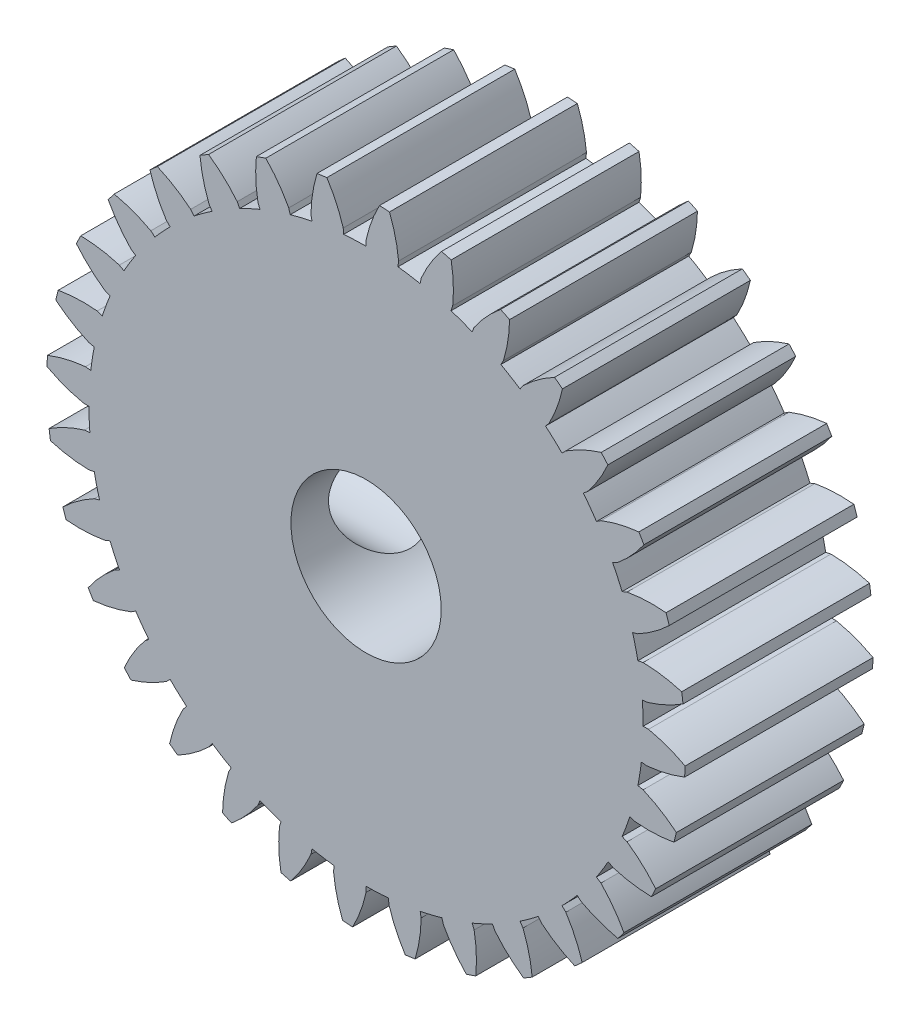
from build123d import *

# Parameters (mm, degrees)
BOSS_EXTRUDE1_DEPTH = 5
CIRPATTERN1_COUNT   = 32
SKETCH6_R           = 7.375
SKETCH6_R_2         = 2
BOSS_EXTRUDE3_DEPTH = 5
SKETCH9_R           = 1.5
CUT_EXTRUDE2_DEPTH  = 9
CUT_EXTRUDE3_START  = 1
CUT_EXTRUDE3_DEPTH  = 3


with BuildPart() as part:
    # Sketch3 → Boss-Extrude1 (new body)
    with BuildSketch(Plane.XY):
        with BuildLine():
            Line((0.865619323, 7.467538106), (0.849206214, 7.32594525))
            ThreePointArc((0.849206214, 7.32594525), (0.425310934, 7.362726099), (0, 7.375))
            Line((0, 7.375), (0, 7.517540966))
            ThreePointArc((0, 7.517540966), (0.144610368, 8.017503247), (0.357372444, 8.492484026))
            ThreePointArc((0.357372444, 8.492484026), (0.490188873, 8.485853809), (0.622885322, 8.477146564))
            ThreePointArc((0.622885322, 8.477146564), (0.779539788, 7.980826285), (0.865619323, 7.467538106))
        make_face()
    extrude(amount=BOSS_EXTRUDE1_DEPTH)


with BuildPart() as cirpattern1_1:
    # CirPattern1: pattern copy
    add(part.part.rotate(Axis((0, 0, 0), (0, 0, 1)), 1 * 360 / CIRPATTERN1_COUNT))


with BuildPart() as cirpattern1_2:
    # CirPattern1: pattern copy
    add(part.part.rotate(Axis((0, 0, 0), (0, 0, 1)), 2 * 360 / CIRPATTERN1_COUNT))


with BuildPart() as cirpattern1_3:
    # CirPattern1: pattern copy
    add(part.part.rotate(Axis((0, 0, 0), (0, 0, 1)), 3 * 360 / CIRPATTERN1_COUNT))


with BuildPart() as cirpattern1_4:
    # CirPattern1: pattern copy
    add(part.part.rotate(Axis((0, 0, 0), (0, 0, 1)), 4 * 360 / CIRPATTERN1_COUNT))


with BuildPart() as cirpattern1_5:
    # CirPattern1: pattern copy
    add(part.part.rotate(Axis((0, 0, 0), (0, 0, 1)), 5 * 360 / CIRPATTERN1_COUNT))


with BuildPart() as cirpattern1_6:
    # CirPattern1: pattern copy
    add(part.part.rotate(Axis((0, 0, 0), (0, 0, 1)), 6 * 360 / CIRPATTERN1_COUNT))


with BuildPart() as cirpattern1_7:
    # CirPattern1: pattern copy
    add(part.part.rotate(Axis((0, 0, 0), (0, 0, 1)), 7 * 360 / CIRPATTERN1_COUNT))


with BuildPart() as cirpattern1_8:
    # CirPattern1: pattern copy
    add(part.part.rotate(Axis((0, 0, 0), (0, 0, 1)), 8 * 360 / CIRPATTERN1_COUNT))


with BuildPart() as cirpattern1_9:
    # CirPattern1: pattern copy
    add(part.part.rotate(Axis((0, 0, 0), (0, 0, 1)), 9 * 360 / CIRPATTERN1_COUNT))


with BuildPart() as cirpattern1_10:
    # CirPattern1: pattern copy
    add(part.part.rotate(Axis((0, 0, 0), (0, 0, 1)), 10 * 360 / CIRPATTERN1_COUNT))


with BuildPart() as cirpattern1_11:
    # CirPattern1: pattern copy
    add(part.part.rotate(Axis((0, 0, 0), (0, 0, 1)), 11 * 360 / CIRPATTERN1_COUNT))


with BuildPart() as cirpattern1_12:
    # CirPattern1: pattern copy
    add(part.part.rotate(Axis((0, 0, 0), (0, 0, 1)), 12 * 360 / CIRPATTERN1_COUNT))


with BuildPart() as cirpattern1_13:
    # CirPattern1: pattern copy
    add(part.part.rotate(Axis((0, 0, 0), (0, 0, 1)), 13 * 360 / CIRPATTERN1_COUNT))


with BuildPart() as cirpattern1_14:
    # CirPattern1: pattern copy
    add(part.part.rotate(Axis((0, 0, 0), (0, 0, 1)), 14 * 360 / CIRPATTERN1_COUNT))


with BuildPart() as cirpattern1_15:
    # CirPattern1: pattern copy
    add(part.part.rotate(Axis((0, 0, 0), (0, 0, 1)), 15 * 360 / CIRPATTERN1_COUNT))


with BuildPart() as cirpattern1_16:
    # CirPattern1: pattern copy
    add(part.part.rotate(Axis((0, 0, 0), (0, 0, 1)), 16 * 360 / CIRPATTERN1_COUNT))


with BuildPart() as cirpattern1_17:
    # CirPattern1: pattern copy
    add(part.part.rotate(Axis((0, 0, 0), (0, 0, 1)), 17 * 360 / CIRPATTERN1_COUNT))


with BuildPart() as cirpattern1_18:
    # CirPattern1: pattern copy
    add(part.part.rotate(Axis((0, 0, 0), (0, 0, 1)), 18 * 360 / CIRPATTERN1_COUNT))


with BuildPart() as cirpattern1_19:
    # CirPattern1: pattern copy
    add(part.part.rotate(Axis((0, 0, 0), (0, 0, 1)), 19 * 360 / CIRPATTERN1_COUNT))


with BuildPart() as cirpattern1_20:
    # CirPattern1: pattern copy
    add(part.part.rotate(Axis((0, 0, 0), (0, 0, 1)), 20 * 360 / CIRPATTERN1_COUNT))


with BuildPart() as cirpattern1_21:
    # CirPattern1: pattern copy
    add(part.part.rotate(Axis((0, 0, 0), (0, 0, 1)), 21 * 360 / CIRPATTERN1_COUNT))


with BuildPart() as cirpattern1_22:
    # CirPattern1: pattern copy
    add(part.part.rotate(Axis((0, 0, 0), (0, 0, 1)), 22 * 360 / CIRPATTERN1_COUNT))


with BuildPart() as cirpattern1_23:
    # CirPattern1: pattern copy
    add(part.part.rotate(Axis((0, 0, 0), (0, 0, 1)), 23 * 360 / CIRPATTERN1_COUNT))


with BuildPart() as cirpattern1_24:
    # CirPattern1: pattern copy
    add(part.part.rotate(Axis((0, 0, 0), (0, 0, 1)), 24 * 360 / CIRPATTERN1_COUNT))


with BuildPart() as cirpattern1_25:
    # CirPattern1: pattern copy
    add(part.part.rotate(Axis((0, 0, 0), (0, 0, 1)), 25 * 360 / CIRPATTERN1_COUNT))


with BuildPart() as cirpattern1_26:
    # CirPattern1: pattern copy
    add(part.part.rotate(Axis((0, 0, 0), (0, 0, 1)), 26 * 360 / CIRPATTERN1_COUNT))


with BuildPart() as cirpattern1_27:
    # CirPattern1: pattern copy
    add(part.part.rotate(Axis((0, 0, 0), (0, 0, 1)), 27 * 360 / CIRPATTERN1_COUNT))


with BuildPart() as cirpattern1_28:
    # CirPattern1: pattern copy
    add(part.part.rotate(Axis((0, 0, 0), (0, 0, 1)), 28 * 360 / CIRPATTERN1_COUNT))


with BuildPart() as cirpattern1_29:
    # CirPattern1: pattern copy
    add(part.part.rotate(Axis((0, 0, 0), (0, 0, 1)), 29 * 360 / CIRPATTERN1_COUNT))


with BuildPart() as cirpattern1_30:
    # CirPattern1: pattern copy
    add(part.part.rotate(Axis((0, 0, 0), (0, 0, 1)), 30 * 360 / CIRPATTERN1_COUNT))


with BuildPart() as cirpattern1_31:
    # CirPattern1: pattern copy
    add(part.part.rotate(Axis((0, 0, 0), (0, 0, 1)), 31 * 360 / CIRPATTERN1_COUNT))


with BuildPart() as part_1:
    add(part.part)

    add(cirpattern1_1.part)  # Boss-Extrude3 merges CirPattern1_1

    add(cirpattern1_2.part)  # Boss-Extrude3 merges CirPattern1_2

    add(cirpattern1_3.part)  # Boss-Extrude3 merges CirPattern1_3

    add(cirpattern1_4.part)  # Boss-Extrude3 merges CirPattern1_4

    add(cirpattern1_5.part)  # Boss-Extrude3 merges CirPattern1_5

    add(cirpattern1_6.part)  # Boss-Extrude3 merges CirPattern1_6

    add(cirpattern1_7.part)  # Boss-Extrude3 merges CirPattern1_7

    add(cirpattern1_8.part)  # Boss-Extrude3 merges CirPattern1_8

    add(cirpattern1_9.part)  # Boss-Extrude3 merges CirPattern1_9

    add(cirpattern1_10.part)  # Boss-Extrude3 merges CirPattern1_10

    add(cirpattern1_11.part)  # Boss-Extrude3 merges CirPattern1_11

    add(cirpattern1_12.part)  # Boss-Extrude3 merges CirPattern1_12

    add(cirpattern1_13.part)  # Boss-Extrude3 merges CirPattern1_13

    add(cirpattern1_14.part)  # Boss-Extrude3 merges CirPattern1_14

    add(cirpattern1_15.part)  # Boss-Extrude3 merges CirPattern1_15

    add(cirpattern1_16.part)  # Boss-Extrude3 merges CirPattern1_16

    add(cirpattern1_17.part)  # Boss-Extrude3 merges CirPattern1_17

    add(cirpattern1_18.part)  # Boss-Extrude3 merges CirPattern1_18

    add(cirpattern1_19.part)  # Boss-Extrude3 merges CirPattern1_19

    add(cirpattern1_20.part)  # Boss-Extrude3 merges CirPattern1_20

    add(cirpattern1_21.part)  # Boss-Extrude3 merges CirPattern1_21

    add(cirpattern1_22.part)  # Boss-Extrude3 merges CirPattern1_22

    add(cirpattern1_23.part)  # Boss-Extrude3 merges CirPattern1_23

    add(cirpattern1_24.part)  # Boss-Extrude3 merges CirPattern1_24

    add(cirpattern1_25.part)  # Boss-Extrude3 merges CirPattern1_25

    add(cirpattern1_26.part)  # Boss-Extrude3 merges CirPattern1_26

    add(cirpattern1_27.part)  # Boss-Extrude3 merges CirPattern1_27

    add(cirpattern1_28.part)  # Boss-Extrude3 merges CirPattern1_28

    add(cirpattern1_29.part)  # Boss-Extrude3 merges CirPattern1_29

    add(cirpattern1_30.part)  # Boss-Extrude3 merges CirPattern1_30

    add(cirpattern1_31.part)  # Boss-Extrude3 merges CirPattern1_31
    # Sketch6 → Boss-Extrude3 (add)
    with BuildSketch(Plane.XY):
        Circle(SKETCH6_R)
        Circle(SKETCH6_R_2, mode=Mode.SUBTRACT)
    extrude(amount=BOSS_EXTRUDE3_DEPTH)

    # Sketch9 → Cut-Extrude2 (cut)
    with BuildSketch(Plane(origin=(0, 0, 0), x_dir=(0, 0, -1), z_dir=(1, 0, 0))):
        with Locations(Location((-2.5, 0, 0), (0, 0, 180))):
            Circle(SKETCH9_R)
    extrude(amount=-CUT_EXTRUDE2_DEPTH, mode=Mode.SUBTRACT)

    # Cut-Extrude3: read off the stored shape, not the designer's step
    # Cut-Extrude3 outline → Cut-Extrude3 (cut)
    with BuildSketch(Plane.XY.offset(CUT_EXTRUDE3_START)):
        with BuildLine():
            ThreePointArc((-7.375, 0), (-7.362726099, 0.425310934), (-7.32594525, 0.849206214))
            Line((-7.32594525, 0.849206214), (-7.467538106, 0.865619323))
            ThreePointArc((-7.467538106, 0.865619323), (-7.980826285, 0.779539788), (-8.477146564, 0.622885322))
            ThreePointArc((-8.477146564, 0.622885322), (-8.485853809, 0.490188873), (-8.492484026, 0.357372444))
            ThreePointArc((-8.492484026, 0.357372444), (-8.017503247, 0.144610368), (-7.517540966, 0))
            Line((-7.517540966, 0), (-7.375, 0))
        make_face()
        with BuildLine():
            ThreePointArc((-7.448064611, 1.5), (-7.410670895, 1.483093628), (-7.373093525, 1.466599488))
            Line((-7.373093525, 1.466599488), (-7.233291443, 1.438791125))
            ThreePointArc((-7.233291443, 1.438791125), (-7.2271338, 1.469408737), (-7.220846557, 1.5))
            Line((-7.220846557, 1.5), (-7.448064611, 1.5))
        make_face()
        with BuildLine():
            ThreePointArc((-8.399023232, -1.306295811), (-7.891661254, -1.42230557), (-7.373093525, -1.466599488))
            Line((-7.373093525, -1.466599488), (-7.233291443, -1.438791125))
            ThreePointArc((-7.233291443, -1.438791125), (-7.304227429, -1.019257902), (-7.35085118, -0.596332063))
            Line((-7.35085118, -0.596332063), (-7.492925408, -0.607857724))
            ThreePointArc((-7.492925408, -0.607857724), (-7.979557615, -0.79242082), (-8.435779468, -1.042892498))
            ThreePointArc((-8.435779468, -1.042892498), (-8.418431613, -1.174737921), (-8.399023232, -1.306295811))
        make_face()
    extrude(amount=CUT_EXTRUDE3_DEPTH, mode=Mode.SUBTRACT)


solid = part_1.part
